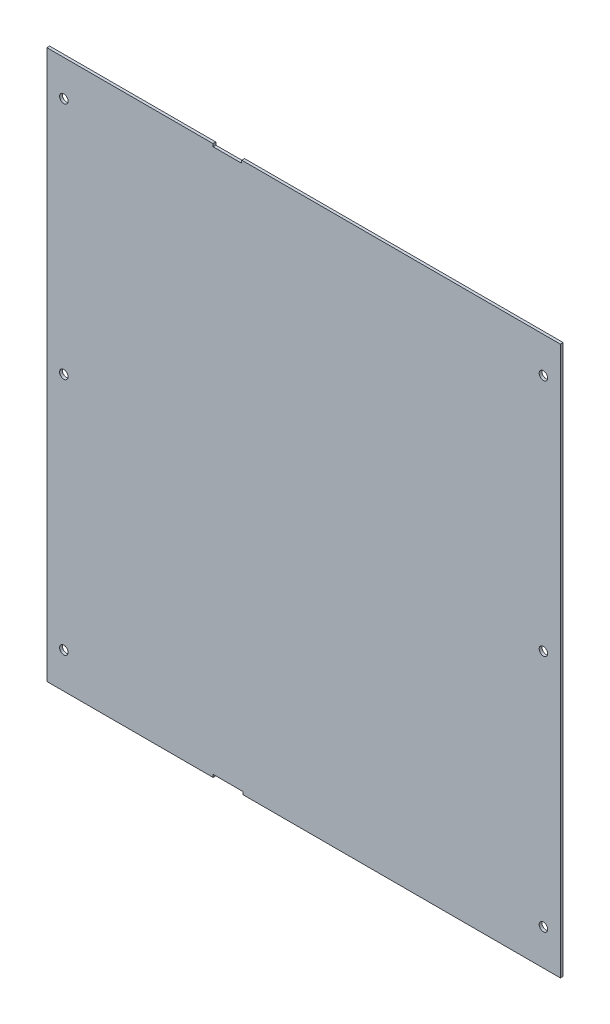
from build123d import *

# Parameters (mm, degrees)
BOSS_EXTRUDE1_DEPTH     = 2.032
CUT_EXTRUDE4_DEPTH      = 276.747138923
CUT_EXTRUDE4_DEPTH_BACK = 276.747138923
SKETCH6_R               = 3.1


with BuildPart() as part:
    # Sketch2 → Boss-Extrude1 (new body)
    with BuildSketch(Plane.XY):
        Polygon((-66.4, 201.34), (-66.4, 199.34), (-45.4, 199.34), (-45.4, 201.34), (188.4, 201.34), (188.4, -201.34), (-44.4, -201.34), (-44.4, -199.34), (-66.4, -199.34), (-66.4, -201.34), (-188.4, -201.34), (-188.4, 201.34), align=None)
    extrude(amount=BOSS_EXTRUDE1_DEPTH)

    # Sketch6 → Cut-Extrude4 (cut, two sides: drawn at the far end of the back side and taken through both)
    with BuildSketch(Plane(origin=(0, 0, 0), x_dir=(-1, 0, 0), z_dir=(0, 0, -1)).offset(-CUT_EXTRUDE4_DEPTH_BACK)):
        with Locations((175.9, -175.117)):
            Circle(SKETCH6_R)
        with Locations((175.9, 175.116996944)):
            Circle(SKETCH6_R)
        with Locations((-175.9, 175.116993888)):
            Circle(SKETCH6_R)
        with Locations((-175.9, -175.117003056)):
            Circle(SKETCH6_R)
        with Locations((-175.9, 0)):
            Circle(SKETCH6_R)
        with Locations((175.9, 0)):
            Circle(SKETCH6_R)
    extrude(amount=CUT_EXTRUDE4_DEPTH + CUT_EXTRUDE4_DEPTH_BACK, mode=Mode.SUBTRACT)


solid = part.part
